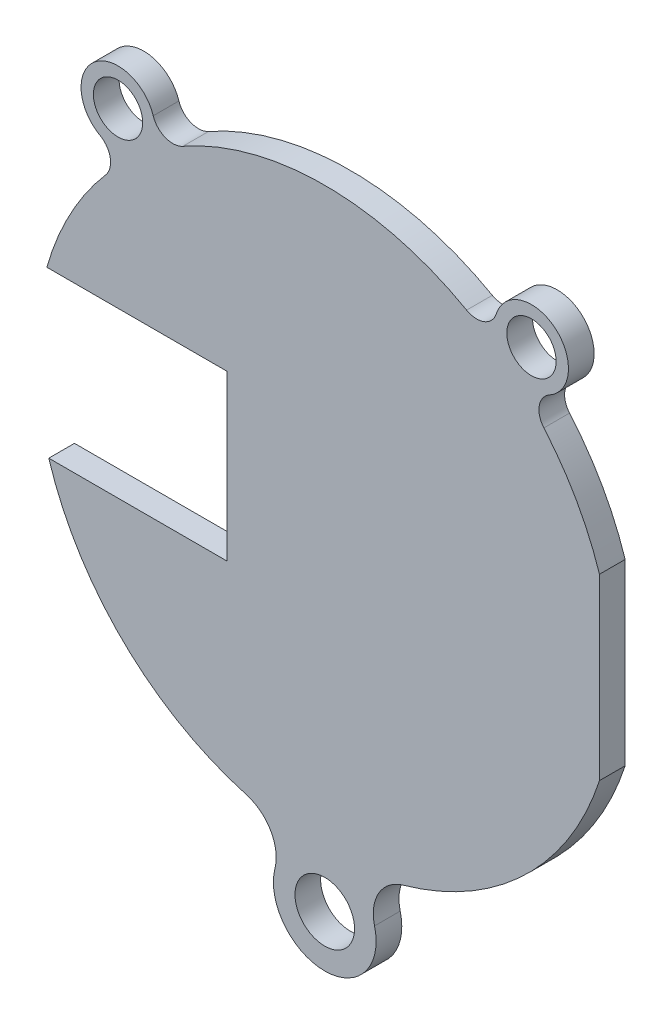
from build123d import *

# Parameters (mm, degrees)
SKETCH1_R           = 1.8415
SKETCH1_R_2         = 1.524
BOSS_EXTRUDE1_DEPTH = 1.5875


with BuildPart() as part:
    # Sketch1 → Boss-Extrude1 (new body)
    with BuildSketch(Plane.XY):
        with BuildLine():
            Line((-6.056265338, 4.8768), (-17.181244816, 4.8768))
            ThreePointArc((-17.181244816, 4.8768), (-15.73141865, 8.455815687), (-13.546192494, 11.63954555))
            ThreePointArc((-13.546192494, 11.63954555), (-13.259158261, 12.690113591), (-13.891550513, 13.576771304))
            ThreePointArc((-13.891550513, 13.576771304), (-14.229434947, 17.341171737), (-10.60343846, 16.274857526))
            ThreePointArc((-10.60343846, 16.274857526), (-9.857305878, 15.481530337), (-8.770915553, 15.557936625))
            ThreePointArc((-8.770915553, 15.557936625), (0, 17.859965052), (8.770915553, 15.557936625))
            ThreePointArc((8.770915553, 15.557936625), (9.857305878, 15.481530337), (10.60343846, 16.274857526))
            ThreePointArc((10.60343846, 16.274857526), (14.229434947, 17.341171737), (13.891550513, 13.576771304))
            ThreePointArc((13.891550513, 13.576771304), (13.259158261, 12.690113591), (13.546192494, 11.63954555))
            ThreePointArc((13.546192494, 11.63954555), (15.568317368, 8.752476564), (16.984058744, 5.5245))
            Line((16.984058744, 5.5245), (16.984058744, -5.5245))
            ThreePointArc((16.984058744, -5.5245), (12.377442365, -12.875452309), (4.850582957, -17.188664772))
            ThreePointArc((4.850582957, -17.188664772), (3.34119056, -18.362373067), (3.078011585, -20.256203417))
            ThreePointArc((3.078011585, -20.256203417), (0, -24.209965052), (-3.078011585, -20.256203417))
            ThreePointArc((-3.078011585, -20.256203417), (-3.34119056, -18.362373067), (-4.850582957, -17.188664772))
            ThreePointArc((-4.850582957, -17.188664772), (-12.468387001, -12.78740307), (-17.060660873, -5.2832))
            Line((-17.060660873, -5.2832), (-6.056265338, -5.2832))
            Line((-6.056265338, -5.2832), (-6.056265338, 4.8768))
        make_face()
        with Locations((0, -21.034965052)):
            Circle(SKETCH1_R, mode=Mode.SUBTRACT)
        with Locations((12.779339593, 15.573965052)):
            Circle(SKETCH1_R_2, mode=Mode.SUBTRACT)
        with Locations((-12.779339593, 15.573965052)):
            Circle(SKETCH1_R_2, mode=Mode.SUBTRACT)
    extrude(amount=BOSS_EXTRUDE1_DEPTH)


solid = part.part
